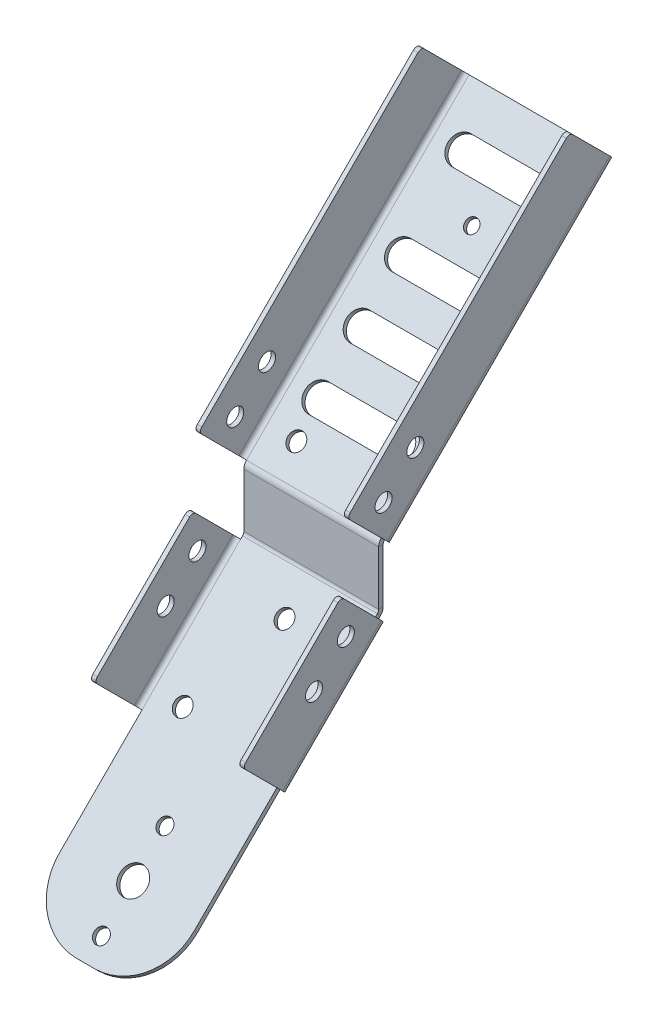
from build123d import *

# Parameters (mm, degrees)
BASE_FLANGE1_DEPTH     = 1
SKETCHED_START         = -30
SKETCHED_BEND5_DEPTH   = 60
SKETCHED_BEND5_2_DEPTH = 15
SKETCHED_START_2       = 15
SKETCHED_BEND5_3_DEPTH = 15
SKETCHED_BEND5_4_DEPTH = 60
SKETCHED_START_3       = -15
SKETCHED_BEND5_5_DEPTH = 30
SKETCHED_BEND6_DEPTH   = 60
SKETCHED_BEND6_2_DEPTH = 15
SKETCHED_BEND6_3_DEPTH = 15
SKETCHED_BEND6_4_DEPTH = 30
SKETCHED_BEND6_5_DEPTH = 60
SKETCHED_START_4       = -36.356310605
SKETCHED_BEND7_DEPTH   = 31
SKETCHED_BEND7_2_DEPTH = 31
SKETCHED_START_5       = 5.890889039
SKETCHED_BEND8_DEPTH   = 70
SKETCHED_BEND8_2_DEPTH = 70
CUT_EXTRUDE1_DEPTH     = 10
F_6_CLEARANCE_HOLE4_D  = 3.7973
F_6_CLEARANCE_HOLE2_D  = 3.7973
FILLET1_R              = 1
F_4_CLEARANCE_HOLE1_D  = 3.2639
F_6_0MM_DOWEL_HOLE1_D  = 6
F_3_0MM_DOWEL_HOLE1_D  = 3
FILLET2_R              = 13


# Read off the part's stored shape, not the designer's step: Sketched Bend5, Sketched Bend6, Sketched Bend7, Sketched Bend8
# Sheet-metal steps are written as plain solids
with BuildPart() as part:
    # Sketch1 → Base-Flange1 (new body)
    with BuildSketch(Plane.XY):
        Polygon((-30, -38.5), (-15, -38.5), (-15, -77.5), (15, -77.5), (15, -38.5), (30, -38.5), (30, -7.5), (15, -7.5), (15, 7.5), (30, 7.5), (30, 77.5), (15, 77.5), (-15, 77.5), (-30, 77.5), (-30, 7.5), (-15, 7.5), (-15, -7.5), (-30, -7.5), align=None)
    extrude(amount=-BASE_FLANGE1_DEPTH)

    # Sketched Bend5 outline → Sketched Bend5 (cut)
    with BuildSketch(Plane.YZ.offset(SKETCHED_START)):
        with BuildLine():
            Line((7.714213562, -0.585786438), (8.128427124, -1))
            Line((8.128427124, -1), (77.5, -1))
            Line((77.5, -1), (77.5, 0))
            Line((77.5, 0), (6.3, 0))
            ThreePointArc((6.3, 0), (7.065366865, -0.152240935), (7.714213562, -0.585786438))
        make_face()
    extrude(amount=SKETCHED_BEND5_DEPTH, mode=Mode.SUBTRACT)

    # Sketched Bend5 2 outline → Sketched Bend5 2 (cut)
    with BuildSketch(Plane.YZ.offset(SKETCHED_START)):
        with BuildLine():
            Line((7.729701149, -0.601274024), (7.714213562, -0.585786438))
            ThreePointArc((7.714213562, -0.585786438), (7.610403483, -0.48909209), (7.5, -0.4))
            Line((7.5, -0.4), (7.5, -0.830975173))
            Line((7.5, -0.830975173), (7.729701149, -0.601274024))
        make_face()
    extrude(amount=SKETCHED_BEND5_2_DEPTH, mode=Mode.SUBTRACT)

    # Sketched Bend5 3 outline → Sketched Bend5 3 (cut)
    with BuildSketch(Plane.YZ.offset(SKETCHED_START_2)):
        with BuildLine():
            Line((7.729701149, -0.601274024), (7.714213562, -0.585786438))
            ThreePointArc((7.714213562, -0.585786438), (7.610403483, -0.48909209), (7.5, -0.4))
            Line((7.5, -0.4), (7.5, -0.830975173))
            Line((7.5, -0.830975173), (7.729701149, -0.601274024))
        make_face()
    extrude(amount=SKETCHED_BEND5_3_DEPTH, mode=Mode.SUBTRACT)

    # Sketched Bend5 4 outline → Sketched Bend5 4 (add)
    with BuildSketch(Plane.YZ.offset(SKETCHED_START)):
        Polygon((57.227175832, -50.098748707), (8.128427124, -1), (7.5, -1), (7.5, -0.830975173), (7.022594368, -1.308380805), (56.520069051, -50.805855488), align=None)
    extrude(amount=SKETCHED_BEND5_4_DEPTH)

    # Sketched Bend5 5 outline → Sketched Bend5 5 (add)
    with BuildSketch(Plane.YZ.offset(SKETCHED_START_3)):
        with BuildLine():
            Line((7.022594368, -1.308380805), (7.330975173, -1))
            Line((7.330975173, -1), (6.3, -1))
            ThreePointArc((6.3, -1), (6.682683432, -1.076120467), (7.007106781, -1.292893219))
            Line((7.007106781, -1.292893219), (7.022594368, -1.308380805))
        make_face()
    extrude(amount=SKETCHED_BEND5_5_DEPTH)

    # Sketched Bend6 outline → Sketched Bend6 (cut)
    with BuildSketch(Plane.YZ.offset(SKETCHED_START)):
        with BuildLine():
            ThreePointArc((-5.710951377, -1), (-6.476318242, -0.847759065), (-7.12516494, -0.414213562))
            Line((-7.12516494, -0.414213562), (-7.539378502, 0))
            Line((-7.539378502, 0), (-77.5, 0))
            Line((-77.5, 0), (-77.5, -1))
            Line((-77.5, -1), (-5.710951377, -1))
        make_face()
    extrude(amount=SKETCHED_BEND6_DEPTH, mode=Mode.SUBTRACT)

    # Sketched Bend6 2 outline → Sketched Bend6 2 (cut)
    with BuildSketch(Plane.YZ.offset(SKETCHED_START)):
        Polygon((-7.539378502, 0), (-7.5, -0.039378502), (-7.5, 0), align=None)
    extrude(amount=SKETCHED_BEND6_2_DEPTH, mode=Mode.SUBTRACT)

    # Sketched Bend6 3 outline → Sketched Bend6 3 (cut)
    with BuildSketch(Plane.YZ.offset(SKETCHED_START_2)):
        Polygon((-7.539378502, 0), (-7.5, -0.039378502), (-7.5, 0), align=None)
    extrude(amount=SKETCHED_BEND6_3_DEPTH, mode=Mode.SUBTRACT)

    # Sketched Bend6 4 outline → Sketched Bend6 4 (add)
    with BuildSketch(Plane.YZ.offset(SKETCHED_START_3)):
        with BuildLine():
            Line((-7.539378502, 0), (-5.710951377, 0))
            ThreePointArc((-5.710951377, 0), (-6.09363481, 0.076120467), (-6.418058159, 0.292893219))
            Line((-6.418058159, 0.292893219), (-56.347540704, 50.222375764))
            Line((-56.347540704, 50.222375764), (-57.054647485, 49.515268983))
            Line((-57.054647485, 49.515268983), (-7.539378502, 0))
        make_face()
    extrude(amount=SKETCHED_BEND6_4_DEPTH)

    # Sketched Bend6 5 outline → Sketched Bend6 5 (add)
    with BuildSketch(Plane.YZ.offset(SKETCHED_START)):
        Polygon((-29.477483019, 21.938104517), (-7.557172802, 0.0177943), (-6.850066021, 0.724901081), (-28.770376238, 22.645211298), align=None)
    extrude(amount=SKETCHED_BEND6_5_DEPTH)

    # Sketched Bend7 outline → Sketched Bend7 (cut)
    with BuildSketch(Plane(origin=(0, 0, 0), x_dir=(1, 0, 0), z_dir=(0, 0.707106781186546, -0.707106781186549)).offset(SKETCHED_START_4)):
        with BuildLine():
            ThreePointArc((-16.732050807, 4.331145665), (-16, 5.063196472), (-15, 5.331145665))
            Line((-15, 5.331145665), (-30, 5.331145665))
            Line((-30, 5.331145665), (-30, 4.331145665))
            Line((-30, 4.331145665), (-16.732050807, 4.331145665))
        make_face()
        with BuildLine():
            Line((30, 5.331145665), (15, 5.331145665))
            ThreePointArc((15, 5.331145665), (16, 5.063196472), (16.732050807, 4.331145665))
            Line((16.732050807, 4.331145665), (30, 4.331145665))
            Line((30, 4.331145665), (30, 5.331145665))
        make_face()
    extrude(amount=SKETCHED_BEND7_DEPTH, mode=Mode.SUBTRACT)

    # Sketched Bend7 2 outline → Sketched Bend7 2 (add)
    with BuildSketch(Plane(origin=(0, 0, 0), x_dir=(1, 0, 0), z_dir=(0, 0.707106781186546, -0.707106781186549)).offset(SKETCHED_START_4)):
        with BuildLine():
            Line((-15, 4.331145665), (-16.732050807, 4.331145665))
            ThreePointArc((-16.732050807, 4.331145665), (-16.931851652, 3.848783755), (-17, 3.331145665))
            Line((-17, 3.331145665), (-17, -9.312659845))
            Line((-17, -9.312659845), (-16, -9.312659845))
            Line((-16, -9.312659845), (-16, 3.331145665))
            ThreePointArc((-16, 3.331145665), (-15.707106781, 4.038252446), (-15, 4.331145665))
        make_face()
        with BuildLine():
            ThreePointArc((17, 3.331145665), (16.931851652, 3.848783755), (16.732050807, 4.331145665))
            Line((16.732050807, 4.331145665), (15, 4.331145665))
            ThreePointArc((15, 4.331145665), (15.707106781, 4.038252446), (16, 3.331145665))
            Line((16, 3.331145665), (16, -9.312659845))
            Line((16, -9.312659845), (17, -9.312659845))
            Line((17, -9.312659845), (17, 3.331145665))
        make_face()
    extrude(amount=SKETCHED_BEND7_2_DEPTH)

    # Sketched Bend8 outline → Sketched Bend8 (cut)
    with BuildSketch(Plane(origin=(0, 0, 0), x_dir=(1, 0, 0), z_dir=(0, 0.707106781186546, -0.707106781186549)).offset(SKETCHED_START_5)):
        with BuildLine():
            Line((-30, -5.040559159), (-16.732050807, -5.040559159))
            ThreePointArc((-16.732050807, -5.040559159), (-16, -4.308508352), (-15, -4.040559159))
            Line((-15, -4.040559159), (-30, -4.040559159))
            Line((-30, -4.040559159), (-30, -5.040559159))
        make_face()
        with BuildLine():
            Line((30, -4.040559159), (15, -4.040559159))
            ThreePointArc((15, -4.040559159), (16, -4.308508352), (16.732050807, -5.040559159))
            Line((16.732050807, -5.040559159), (30, -5.040559159))
            Line((30, -5.040559159), (30, -4.040559159))
        make_face()
    extrude(amount=SKETCHED_BEND8_DEPTH, mode=Mode.SUBTRACT)

    # Sketched Bend8 2 outline → Sketched Bend8 2 (add)
    with BuildSketch(Plane(origin=(0, 0, 0), x_dir=(1, 0, 0), z_dir=(0, 0.707106781186546, -0.707106781186549)).offset(SKETCHED_START_5)):
        with BuildLine():
            ThreePointArc((-16.732050807, -5.040559159), (-16.931851652, -5.522921069), (-17, -6.040559159))
            Line((-17, -6.040559159), (-17, -18.684364669))
            Line((-17, -18.684364669), (-16, -18.684364669))
            Line((-16, -18.684364669), (-16, -6.040559159))
            ThreePointArc((-16, -6.040559159), (-15.707106781, -5.333452378), (-15, -5.040559159))
            Line((-15, -5.040559159), (-16.732050807, -5.040559159))
        make_face()
        with BuildLine():
            Line((16.732050807, -5.040559159), (15, -5.040559159))
            ThreePointArc((15, -5.040559159), (15.707106781, -5.333452378), (16, -6.040559159))
            Line((16, -6.040559159), (16, -18.684364669))
            Line((16, -18.684364669), (17, -18.684364669))
            Line((17, -18.684364669), (17, -6.040559159))
            ThreePointArc((17, -6.040559159), (16.931851652, -5.522921069), (16.732050807, -5.040559159))
        make_face()
    extrude(amount=SKETCHED_BEND8_2_DEPTH)

    # Sketch36 → Cut-Extrude1 (cut)
    with BuildSketch(Plane(origin=(0, 3.564213562, 3.564213562), x_dir=(1, 0, 0), z_dir=(0, 0.7071067811865487, 0.7071067811865465))):
        with BuildLine():
            Line((-9, 23), (9, 23))
            ThreePointArc((9, 23), (12, 20), (9, 17))
            Line((9, 17), (-9, 17))
            ThreePointArc((-9, 17), (-12, 20), (-9, 23))
        make_face()
        with BuildLine():
            Line((-9, 36), (9, 36))
            ThreePointArc((9, 36), (12, 33), (9, 30))
            Line((9, 30), (-9, 30))
            ThreePointArc((-9, 30), (-12, 33), (-9, 36))
        make_face()
        with BuildLine():
            Line((-9, 49), (9, 49))
            ThreePointArc((9, 49), (12, 46), (9, 43))
            Line((9, 43), (-9, 43))
            ThreePointArc((-9, 43), (-12, 46), (-9, 49))
        make_face()
        with BuildLine():
            Line((-9, 68), (9, 68))
            ThreePointArc((9, 68), (12, 65), (9, 62))
            Line((9, 62), (-9, 62))
            ThreePointArc((-9, 62), (-12, 65), (-9, 68))
        make_face()
    extrude(amount=-CUT_EXTRUDE1_DEPTH, mode=Mode.SUBTRACT)

    # #6 Clearance Hole4 (through all)
    with Locations(Plane(origin=(0, 3.564213562, 3.564213562), x_dir=(1, 0, 0), z_dir=(0, 0.7071067811865487, 0.7071067811865465))):
        with Locations((-8.5, 12.368986284), (8.5, 12.368986284), (0, -12.745359227), (-8.5, -32.745359227), (8.5, -32.745359227)):
            Hole(F_6_CLEARANCE_HOLE4_D / 2)

    # #6 Clearance Hole2 (through all)
    with Locations(Plane(origin=(17, 0, 0), x_dir=(0, 0, -1), z_dir=(1, 0, 0))):
        with Locations((-9.311868306, -5.334166607), (-16.382936118, -12.405234419), (-0.914625389, 16.316668374), (6.156442422, 23.387736186)):
            Hole(F_6_CLEARANCE_HOLE2_D / 2)

    # Fillet1
    fillet1_edges = [part.edges().sort_by_distance(p)[0] for p in [
        (-16.5, -19.12274884, 32.292838695),
        (-16.5, 2.797561376, 10.372528478),
        (16.5, 2.797561376, 10.372528478),
        (16.5, -19.12274884, 32.292838695),
        (-16.5, 17.377328546, 9.046353373),
        (-16.5, 66.874803229, -40.45112131),
        (16.5, 66.874803229, -40.45112131),
        (16.5, 17.377328546, 9.046353373),
    ]]
    fillet(fillet1_edges, radius=FILLET1_R)

    # #4 Clearance Hole1 (through all)
    with Locations(Plane(origin=(0, -3.06258247, -3.06258247), x_dir=(1, 0, 0), z_dir=(0, 0.7071067811865487, 0.7071067811865465))):
        with Locations((0, -70.356310605), (0, -50.356310605)):
            Hole(F_4_CLEARANCE_HOLE1_D / 2)

    # Ø6.0mm Dowel Hole1 (through all)
    with Locations(Plane(origin=(0, -3.06258247, -3.06258247), x_dir=(1, 0, 0), z_dir=(0, 0.7071067811865487, 0.7071067811865465))):
        with Locations((0, -60.356310605)):
            Hole(F_6_0MM_DOWEL_HOLE1_D / 2)

    # Ø3.0mm Dowel Hole1 (through all)
    with Locations(Plane(origin=(0, 3.564213562, 3.564213562), x_dir=(1, 0, 0), z_dir=(0, 0.7071067811865487, 0.7071067811865465))):
        with Locations((0, 55.530889039)):
            Hole(F_3_0MM_DOWEL_HOLE1_D / 2)

    # Fillet2
    fillet2_edges = [part.edges().sort_by_distance(p)[0] for p in [
        (-15, -56.701094094, 49.868822373),
        (15, -56.701094094, 49.868822373),
    ]]
    fillet(fillet2_edges, radius=FILLET2_R)


solid = part.part
